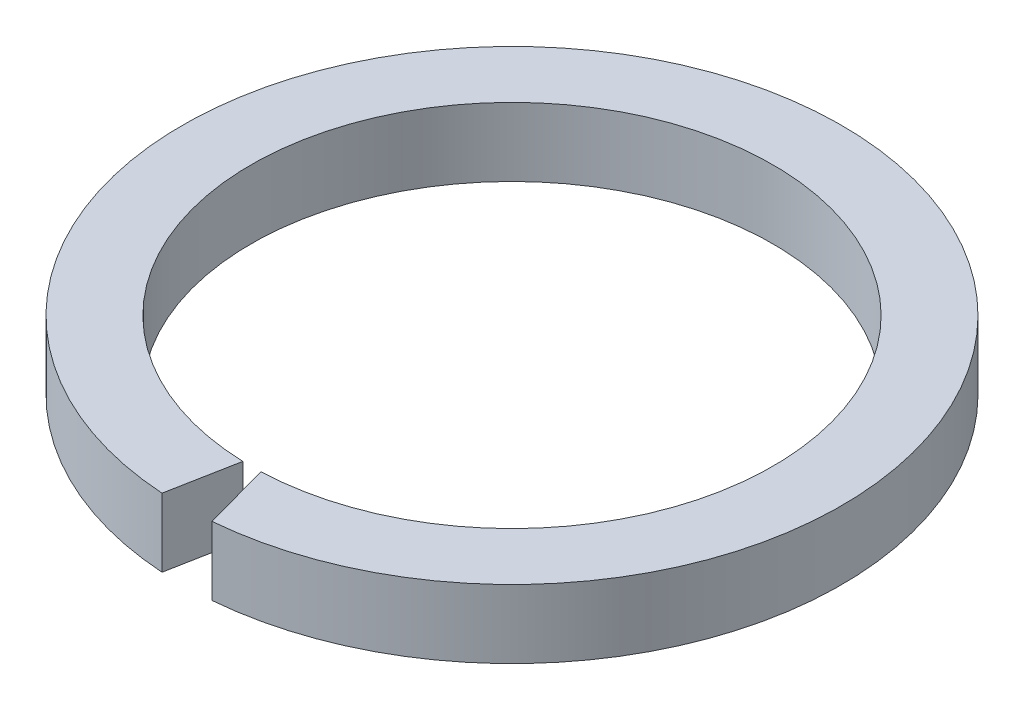
from build123d import *

# Parameters (mm, degrees)
SKETCH1_R               = 24.05
SKETCH1_R_2             = 19.05
BOSS_EXTRUDE1_DEPTH     = 5
CUT_EXTRUDE2_DEPTH      = 15
CUT_EXTRUDE2_DEPTH_BACK = 12


with BuildPart() as part:
    # Sketch1 → Boss-Extrude1 (new body)
    with BuildSketch(Plane(origin=(0, 0, 0), x_dir=(1, 0, 0), z_dir=(0, 1, 0))):
        Circle(SKETCH1_R)
        Circle(SKETCH1_R_2, mode=Mode.SUBTRACT)
    extrude(amount=BOSS_EXTRUDE1_DEPTH)

    # Sketch3 → Cut-Extrude2 (cut, two sides: drawn at the far end of the back side and taken through both)
    with BuildSketch(Plane(origin=(0, 0, 0), x_dir=(1, 0, 0), z_dir=(0, 1, 0)).offset(-CUT_EXTRUDE2_DEPTH_BACK)):
        Polygon((-1.697883955, -24.829645497), (2.285613016, -24.829645497), (0.427942364, -17.921749567), (0, -17.921749567), (-0.388197347, -17.921749567), align=None)
    extrude(amount=CUT_EXTRUDE2_DEPTH + CUT_EXTRUDE2_DEPTH_BACK, mode=Mode.SUBTRACT)


solid = part.part
